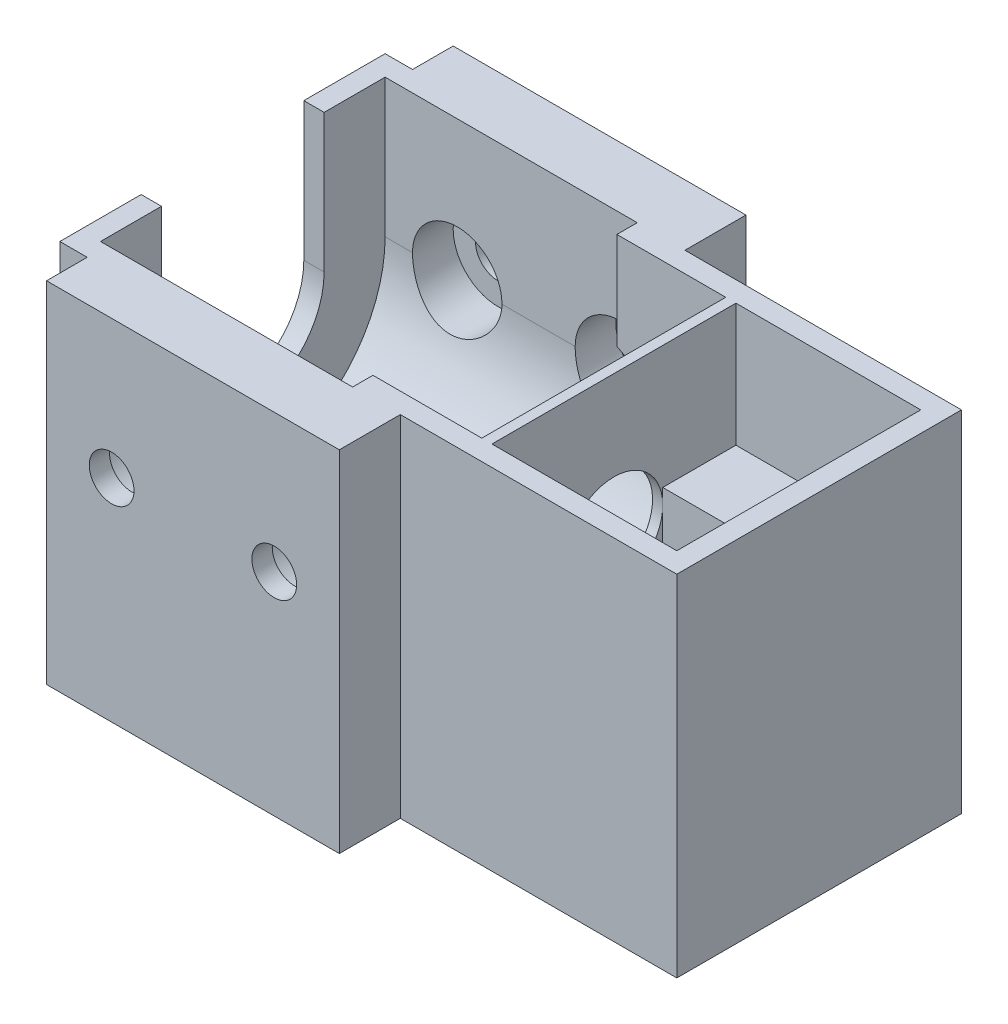
from build123d import *
from build123d.topology import SkipClean

# Parameters (mm, degrees)
SKETCH1_W                       = 116.84
SKETCH1_H                       = 50.8
BOSS_EXTRUDE1_DEPTH             = 31.75
SKETCH38_W                      = 20
SKETCH38_H                      = 20
CUT_EXTRUDE33_DEPTH             = 32.0434
SKETCH37_W                      = 63.5
SKETCH37_H                      = 25.4
CUT_EXTRUDE32_DEPTH             = 132.302277589
BOSS_EXTRUDE5_DEPTH             = 25.4
BOSS_EXTRUDE6_REACH             = 98.929
SKETCH40_W                      = 15.6309
SKETCH40_H                      = 20
SKETCH41_R                      = 3.113413941
CUT_EXTRUDE34_DEPTH             = 97.928543268
CUT_EXTRUDE35_DEPTH             = 97.928543399
CUT_EXTRUDE35_DEPTH_BACK        = 97.928543399
SKETCH42_R                      = 3.4925
SKETCH43_R                      = 6.985
CUT_EXTRUDE36_DEPTH             = 28.575
CUT_EXTRUDE37_START             = 28.575
SKETCH43_2_R                    = 6.985
CUT_EXTRUDE37_DEPTH             = 28.575
SKETCH44_W                      = 15.9125
SKETCH44_H                      = 38.1
CUT_EXTRUDE38_DEPTH             = 35.4
CUT_EXTRUDE39_REACH             = 98.929
SKETCH45_W                      = 12.9559
SKETCH45_H                      = 15.4
CUT_EXTRUDE39_DIRECTION_2_REACH = 98.929
SKETCH46_W                      = 43.18
SKETCH46_H                      = 9.525
SKETCH46_W_2                    = 27.94
SKETCH46_H_2                    = 6.35
CUT_EXTRUDE40_DEPTH             = 97.928543399
SKETCH49_W                      = 23.6641
SKETCH49_H                      = 50.8
CUT_EXTRUDE42_DEPTH             = 97.928543399
SKETCH50_W                      = 0.254
SKETCH50_H                      = 1.524
CUT_EXTRUDE43_DEPTH             = 2.54
SKETCH52_R                      = 0.3175
CUT_EXTRUDE45_DEPTH             = 0.0508
SKETCH53_R                      = 2
CUT_EXTRUDE46_DEPTH             = 0.0254
BOSS_EXTRUDE7_DEPTH             = 2.54
SKETCH55_W                      = 15.9125
SKETCH55_H                      = 9.05
BOSS_EXTRUDE8_DEPTH             = 17.46
BOSS_EXTRUDE9_REACH             = 81.679
BOSS_EXTRUDE9_DIRECTION_2_REACH = 81.679
CUT_EXTRUDE47_DEPTH             = 7.62
SKETCH58_R                      = 3.113413941
BOSS_EXTRUDE10_DEPTH            = 7.62
SKETCH59_W                      = 0.5
SKETCH59_H                      = 20
CUT_EXTRUDE48_DEPTH             = 7.62
CUT_LABEL_DEPTH                 = 0.635
SKETCH60_W                      = 121.35651469
SKETCH60_H                      = 81.059088534
CUT_EXTRUDE49_DEPTH             = 10.16
SKETCH61_R                      = 8.976217823
SKETCH61_R_2                    = 7.62
BOSS_EXTRUDE11_DEPTH            = 1.5875
BOSS_EXTRUDE12_REACH            = 80.084
SKETCH62_W                      = 1.5875
SKETCH62_H                      = 15.24
SKETCH64_W                      = 28.8684
SKETCH64_H                      = 38.1
BOSS_EXTRUDE14_DEPTH            = 6.35
BOSS_EXTRUDE16_REACH            = 92.322
SKETCH65_W                      = 2.38
SKETCH65_H                      = 9.84
SKETCH66_W                      = 0.5
SKETCH66_H                      = 20
CUT_EXTRUDE50_DEPTH             = 20


with BuildPart() as part:
    # Sketch1 → Boss-Extrude1 (new, symmetric)
    with BuildSketch(Plane.XY):
        with Locations((-17.78, -25.4)):
            Rectangle(SKETCH1_W, SKETCH1_H)
    extrude(amount=BOSS_EXTRUDE1_DEPTH, both=True)

    # Sketch2 → Cut-Revolve1 (revolve, cut)
    with BuildSketch(Plane.XY, mode=Mode.PRIVATE) as cut_revolve1_sk:
        Polygon((-49.3609, -3.175), (-49.3609, -12.7), (-220.202391615, -12.7), (-220.202391615, -25.4), (-157.809194346, -25.4), (-128.417210056, -25.4), (9.3782, -25.4), (40.64, -25.4), (40.64, -17.78), (25.0091, -17.78), (7.0091, -17.78), (7.0091, -6.35), (-9.9909, -6.35), (-9.9909, -3.175), align=None)
    revolve(cut_revolve1_sk.sketch.rotate(Axis((-152.482877195, -25.4, 0), (1, 0, 0)), 180), axis=Axis((-152.482877195, -25.4, 0), (1, 0, 0)), mode=Mode.SUBTRACT)

    # Sketch38 → Cut-Extrude33 (cut)
    with BuildSketch(Plane(origin=(40.64, 0, 0), x_dir=(0, 0, -1), z_dir=(1, 0, 0))):
        with Locations((0, -25.4)):
            Rectangle(SKETCH38_W, SKETCH38_H)
    extrude(amount=-CUT_EXTRUDE33_DEPTH, mode=Mode.SUBTRACT)

    # Sketch37 → Cut-Extrude32 (cut, through all)
    with BuildSketch(Plane(origin=(40.64, 0, 0), x_dir=(0, 0, -1), z_dir=(1, 0, 0))):
        with Locations((0, -12.7)):
            Rectangle(SKETCH37_W, SKETCH37_H)
    extrude(amount=-CUT_EXTRUDE32_DEPTH, mode=Mode.SUBTRACT)

    # Sketch39 → Boss-Extrude5 (add)
    with BuildSketch(Plane(origin=(0, -25.4, 0), x_dir=(1, 0, 0), z_dir=(0, 1, 0))):
        Polygon((7.0091, 19.05), (7.0091, 7.62), (8.5966, 7.62), (8.5966, 10), (40.64, 10), (40.64, 31.75), (-76.2, 31.75), (-76.2, 12.7), (-49.3609, 12.7), (-49.3609, 22.225), (-9.9909, 22.225), (-9.9909, 19.05), align=None)
        Polygon((40.64, -10), (8.5966, -10), (8.5966, -7.62), (7.0091, -7.62), (7.0091, -19.05), (-9.9909, -19.05), (-9.9909, -22.225), (-49.3609, -22.225), (-49.3609, -12.7), (-76.2, -12.7), (-76.2, -31.75), (40.64, -31.75), align=None)
    extrude(amount=BOSS_EXTRUDE5_DEPTH)

    # Sketch40 → Boss-Extrude6 (add, up to next)
    with BuildSketch(Plane(origin=(0, 0, 0), x_dir=(1, 0, 0), z_dir=(0, 1, 0)), mode=Mode.PRIVATE) as boss_extrude6_sk1:
        with Locations((32.82455, 0)):
            Rectangle(SKETCH40_W, SKETCH40_H)
    boss_extrude6_tool1 = extrude(boss_extrude6_sk1.sketch, amount=-BOSS_EXTRUDE6_REACH, mode=Mode.PRIVATE) - part.part
    add(boss_extrude6_tool1.solids().sort_by_distance((32.82455, 0, 0))[0])

    # Sketch41 → Cut-Extrude34 (cut, through all)
    with BuildSketch(Plane(origin=(0, 0, 0), x_dir=(1, 0, 0), z_dir=(0, 1, 0))):
        with Locations(Location((-57.15, 0, 0), (0, 0, 270))):
            Circle(SKETCH41_R)
        with Locations(Location((-31.75, 0, 0), (0, 0, 270))):
            Circle(SKETCH41_R)
        with Locations(Location((-6.35, 0, 0), (0, 0, 270))):
            Circle(SKETCH41_R)
    extrude(amount=-CUT_EXTRUDE34_DEPTH, mode=Mode.SUBTRACT)

    # Sketch42 → Cut-Extrude35 (cut, two sides: drawn at the far end of the back side and taken through both)
    with BuildSketch(Plane.XY.offset(-CUT_EXTRUDE35_DEPTH_BACK)):
        with Locations((-38.1, -25.4)):
            Circle(SKETCH42_R)
        with Locations((-12.7, -25.4)):
            Circle(SKETCH42_R)
    extrude(amount=CUT_EXTRUDE35_DEPTH + CUT_EXTRUDE35_DEPTH_BACK, mode=Mode.SUBTRACT)

    # Sketch43 → Cut-Extrude36 (cut)
    with BuildSketch(Plane.XY):
        with Locations(Location((-38.1, -25.4, 0), (0, 0, 180))):
            Circle(SKETCH43_R)
        with Locations(Location((-12.7, -25.4, 0), (0, 0, 180))):
            Circle(SKETCH43_R)
    extrude(amount=-CUT_EXTRUDE36_DEPTH, mode=Mode.SUBTRACT)

    # Sketch43<2> → Cut-Extrude37 (cut)
    with BuildSketch(Plane.XY.offset(CUT_EXTRUDE37_START)):
        with Locations(Location((-38.1, -25.4, 0), (0, 0, 180))):
            Circle(SKETCH43_2_R)
        with Locations(Location((-12.7, -25.4, 0), (0, 0, 180))):
            Circle(SKETCH43_2_R)
    extrude(amount=-CUT_EXTRUDE37_DEPTH, mode=Mode.SUBTRACT)

    # Sketch44 → Cut-Extrude38 (cut)
    with BuildSketch(Plane(origin=(0, 0, 0), x_dir=(1, 0, 0), z_dir=(0, 1, 0))):
        with Locations((16.55285, 0)):
            Rectangle(SKETCH44_W, SKETCH44_H)
    extrude(amount=-CUT_EXTRUDE38_DEPTH, mode=Mode.SUBTRACT)

    # Cut-Extrude39: up to this face of the body (flat: up to its plane)
    cut_extrude39_end = Plane(part.part.faces().sort_by_distance((16.55285, -17.7, -19.05))[0])
    # Sketch45 → Cut-Extrude39 (cut, up to the picked face)
    with BuildSketch(Plane.XY, mode=Mode.PRIVATE) as cut_extrude39_sk1:
        with Locations((30.98705, -7.7)):
            Rectangle(SKETCH45_W, SKETCH45_H)
    cut_extrude39_tool1 = split(extrude(cut_extrude39_sk1.sketch, amount=-CUT_EXTRUDE39_REACH, mode=Mode.PRIVATE), bisect_by=cut_extrude39_end, keep=Keep.BOTH, mode=Mode.PRIVATE)
    add(cut_extrude39_tool1.solids().sort_by(Axis((30.98705, -7.7, 0), (0, 0, -1)))[0], mode=Mode.SUBTRACT)

    # Cut-Extrude39 direction 2: up to this face of the body (flat: up to its plane)
    cut_extrude39_direction_2_end = Plane(part.part.faces().sort_by_distance((16.55285, -17.7, 19.05))[0])
    # Sketch45 → Cut-Extrude39 direction 2 (cut, up to the picked face)
    with BuildSketch(Plane.XY, mode=Mode.PRIVATE) as cut_extrude39_direction_2_sk1:
        with Locations((30.98705, -7.7)):
            Rectangle(SKETCH45_W, SKETCH45_H)
    cut_extrude39_direction_2_tool1 = split(extrude(cut_extrude39_direction_2_sk1.sketch, amount=CUT_EXTRUDE39_DIRECTION_2_REACH, mode=Mode.PRIVATE), bisect_by=cut_extrude39_direction_2_end, keep=Keep.BOTH, mode=Mode.PRIVATE)
    add(cut_extrude39_direction_2_tool1.solids().sort_by(Axis((30.98705, -7.7, 0), (0, 0, 1)))[0], mode=Mode.SUBTRACT)

    # Sketch46 → Cut-Extrude40 (cut, through all)
    with BuildSketch(Plane(origin=(0, 0, 0), x_dir=(1, 0, 0), z_dir=(0, 1, 0))):
        with Locations((19.05, 26.9875)):
            Rectangle(SKETCH46_W, SKETCH46_H)
        with Locations((19.05, -26.9875)):
            Rectangle(SKETCH46_W, SKETCH46_H)
        with Locations((-62.23, 28.575)):
            Rectangle(SKETCH46_W_2, SKETCH46_H_2)
        with Locations((-62.23, -28.575)):
            Rectangle(SKETCH46_W_2, SKETCH46_H_2)
    extrude(amount=-CUT_EXTRUDE40_DEPTH, mode=Mode.SUBTRACT)

    # Sketch49 → Cut-Extrude42 (cut, through all)
    with BuildSketch(Plane(origin=(0, 0, 0), x_dir=(1, 0, 0), z_dir=(0, 1, 0))):
        with Locations((-64.36795, 0)):
            Rectangle(SKETCH49_W, SKETCH49_H)
    extrude(amount=-CUT_EXTRUDE42_DEPTH, mode=Mode.SUBTRACT)

    # Sketch50 → Cut-Extrude43 (cut)
    with BuildSketch(Plane(origin=(0, 0, 0), x_dir=(1, 0, 0), z_dir=(0, 1, 0))):
        with Locations((24.3821, 21.463)):
            Rectangle(SKETCH50_W, SKETCH50_H)
        with Locations((22.8581, 21.463)):
            Rectangle(SKETCH50_W, SKETCH50_H)
        with Locations((21.3341, 21.463)):
            Rectangle(SKETCH50_W, SKETCH50_H)
        with Locations((19.8101, 21.463)):
            Rectangle(SKETCH50_W, SKETCH50_H)
        with Locations((18.2861, 21.463)):
            Rectangle(SKETCH50_W, SKETCH50_H)
        with Locations((16.7621, 21.463)):
            Rectangle(SKETCH50_W, SKETCH50_H)
        with Locations((15.2381, 21.463)):
            Rectangle(SKETCH50_W, SKETCH50_H)
        with Locations((13.7141, 21.463)):
            Rectangle(SKETCH50_W, SKETCH50_H)
        with Locations((12.1901, 21.463)):
            Rectangle(SKETCH50_W, SKETCH50_H)
        with Locations((10.6661, 21.463)):
            Rectangle(SKETCH50_W, SKETCH50_H)
    extrude(amount=-CUT_EXTRUDE43_DEPTH, mode=Mode.SUBTRACT)

    # Sketch52 → Cut-Extrude45 (cut)
    with BuildSketch(Plane.ZY.offset(-25.0091)):
        with Locations(Location((0, -25.4, 0), (0, 0, 270))):
            Circle(SKETCH52_R)
    extrude(amount=-CUT_EXTRUDE45_DEPTH, mode=Mode.SUBTRACT)

    # Sketch53 → Cut-Extrude46 (cut)
    with BuildSketch(Plane.ZY.offset(-25.0091)):
        with Locations(Location((0, -25.4, 0), (0, 0, 270))):
            Circle(SKETCH53_R)
    extrude(amount=-CUT_EXTRUDE46_DEPTH, mode=Mode.SUBTRACT)

    # Sketch54 → Boss-Extrude7 (add)
    with BuildSketch(Plane(origin=(0, -35.4, 0), x_dir=(1, 0, 0), z_dir=(0, 1, 0))):
        Polygon((24.5091, 10), (24.5091, -10), (24.5091, -19.05), (8.5966, -19.05), (8.5966, 19.05), (24.5091, 19.05), align=None)
    extrude(amount=BOSS_EXTRUDE7_DEPTH)

    # Sketch55 → Boss-Extrude8 (add)
    with BuildSketch(Plane(origin=(0, -32.86, 0), x_dir=(1, 0, 0), z_dir=(0, 1, 0))):
        with Locations((16.55285, 14.525)):
            Rectangle(SKETCH55_W, SKETCH55_H)
        with Locations((16.55285, -14.525)):
            Rectangle(SKETCH55_W, SKETCH55_H)
    extrude(amount=BOSS_EXTRUDE8_DEPTH)

    # Sketch56 → Boss-Extrude9 (add, up to next)
    with BuildSketch(Plane.XY, mode=Mode.PRIVATE) as boss_extrude9_sk1:
        with BuildLine():
            Line((18.1591, -27.4), (24.5091, -27.4))
            Line((24.5091, -27.4), (24.5091, -32.86))
            Line((24.5091, -32.86), (8.5966, -32.86))
            add(Edge.make_bspline(
                [(8.5966, -32.86), (9.528769565, -32.86), (16.494480894, -27.985980084), (16.841325546, -27.4), (18.1591, -27.4)],
                knots=[0, 0, 0, 0, 0.327130602, 1, 1, 1, 1], degree=3))
        make_face()
    boss_extrude9_tool1 = extrude(boss_extrude9_sk1.sketch, amount=BOSS_EXTRUDE9_REACH, mode=Mode.PRIVATE) - part.part
    add(boss_extrude9_tool1.solids().sort_by_distance((18.670191, -30.455241, 0))[0])

    # Sketch56 → Boss-Extrude9 direction 2 (add, up to next)
    with BuildSketch(Plane.XY, mode=Mode.PRIVATE) as boss_extrude9_direction_2_sk1:
        with BuildLine():
            Line((18.1591, -27.4), (24.5091, -27.4))
            Line((24.5091, -27.4), (24.5091, -32.86))
            Line((24.5091, -32.86), (8.5966, -32.86))
            add(Edge.make_bspline(
                [(8.5966, -32.86), (9.528769565, -32.86), (16.494480894, -27.985980084), (16.841325546, -27.4), (18.1591, -27.4)],
                knots=[0, 0, 0, 0, 0.327130602, 1, 1, 1, 1], degree=3))
        make_face()
    boss_extrude9_direction_2_tool1 = extrude(boss_extrude9_direction_2_sk1.sketch, amount=-BOSS_EXTRUDE9_DIRECTION_2_REACH, mode=Mode.PRIVATE) - part.part
    add(boss_extrude9_direction_2_tool1.solids().sort_by_distance((18.670191, -30.455241, 0))[0])

    # Sketch57 → Cut-Extrude47 (cut)
    with BuildSketch(Plane(origin=(0, -15.4, 0), x_dir=(1, 0, 0), z_dir=(0, 1, 0))):
        Polygon((25.0091, -10), (8.5966, -10), (8.5966, -19.05), (37.465, -19.05), (37.465, 19.05), (8.5966, 19.05), (8.5966, 10), (25.0091, 10), align=None)
    extrude(amount=-CUT_EXTRUDE47_DEPTH, mode=Mode.SUBTRACT)

    # Sketch58 → Boss-Extrude10 (add)
    with SkipClean():  # the faces are left unmerged after this step: merging them gives an invalid solid
        with BuildSketch(Plane.XZ.offset(50.8)):
            Polygon((-48.26, 25.4), (-52.5359, 25.4), (-52.5359, -25.4), (-48.26, -25.4), (-48.26, -31.75), (-2.54, -31.75), (-2.54, -22.225), (40.64, -22.225), (40.64, 22.225), (-2.54, 22.225), (-2.54, 31.75), (-48.26, 31.75), align=None)
            with Locations((-31.75, 0)):
                Circle(SKETCH58_R, mode=Mode.SUBTRACT)
            with Locations(Location((-6.35, 0, 0), (0, 0, 90))):
                Circle(SKETCH58_R, mode=Mode.SUBTRACT)
        extrude(amount=BOSS_EXTRUDE10_DEPTH)

    # Sketch59 → Cut-Extrude48 (cut)
    with SkipClean():  # the faces are left unmerged after this step: merging them gives an invalid solid
        with BuildSketch(Plane(origin=(0, -35.4, 0), x_dir=(1, 0, 0), z_dir=(0, 1, 0))):
            with Locations((24.7591, 0)):
                Rectangle(SKETCH59_W, SKETCH59_H)
        extrude(amount=-CUT_EXTRUDE48_DEPTH, mode=Mode.SUBTRACT)

    # Sketch51 → Cut-Label (cut)
    # profile 1 of 3: a face of its own
    with SkipClean():  # the faces are left unmerged after this step: merging them gives an invalid solid
        with BuildSketch(Plane(origin=(0, -23.02, 0), x_dir=(1, 0, 0), z_dir=(0, 1, 0))):
            Polygon((26.20246966, 0.254), (27.21268828, 0.254), (27.21268828, 2.54), (27.72068828, 2.54), (27.72068828, 0.254), (28.7309069, 0.254), (28.7309069, 2.54), (29.2389069, 2.54), (29.2389069, 0.254), (30.24912552, 0.254), (30.24912552, 2.54), (30.75712552, 2.54), (30.75712552, 0.254), (31.76734414, 0.254), (31.76734414, 2.54), (32.27534414, 2.54), (32.27534414, 0.254), (33.28556276, 0.254), (33.28556276, 2.54), (33.79356276, 2.54), (33.79356276, 0.254), (34.80378138, 0.254), (34.80378138, 2.54), (35.31178138, 2.54), (35.31178138, 0.254), (36.322, 0.254), (36.322, 2.54), (36.83, 2.54), (36.83, 0.254), (37.465, 0.254), (37.465, -0.254), (36.83, -0.254), (36.83, -2.54), (36.322, -2.54), (36.322, -0.254), (35.31178138, -0.254), (35.31178138, -2.54), (34.80378138, -2.54), (34.80378138, -0.254), (33.79356276, -0.254), (33.79356276, -2.54), (33.28556276, -2.54), (33.28556276, -0.254), (32.27534414, -0.254), (32.27534414, -2.54), (31.76734414, -2.54), (31.76734414, -0.254), (30.75712552, -0.254), (30.75712552, -2.54), (30.24912552, -2.54), (30.24912552, -0.254), (29.2389069, -0.254), (29.2389069, -2.54), (28.7309069, -2.54), (28.7309069, -0.254), (27.72068828, -0.254), (27.72068828, -2.54), (27.21268828, -2.54), (27.21268828, -0.254), (26.20246966, -0.254), (26.20246966, -2.54), (25.69446966, -2.54), (25.69446966, -0.254), (25.0091, -0.254), (25.0091, 0.254), (25.69446966, 0.254), (25.69446966, 2.54), (26.20246966, 2.54), align=None)
        # profile 2 of 3: a face of its own
        with BuildSketch(Plane(origin=(0, -23.02, 0), x_dir=(1, 0, 0), z_dir=(0, 1, 0))):
            Polygon((27.745064103, 14.333054385), (28.384487179, 14.333054385), (29.046346154, 12.82353916), (29.708205128, 14.333054385), (30.347628205, 14.333054385), (29.227235577, 11.775362077), (28.865456731, 11.775362077), align=None)
        # profile 3 of 3: a face of its own
        with BuildSketch(Plane(origin=(0, -23.02, 0), x_dir=(1, 0, 0), z_dir=(0, 1, 0))):
            with BuildLine():
                add(Edge.make_bspline(
                    [(32.448189103, 13.659977461), (32.484891011, 13.633752956), (32.557539127, 13.581843914), (32.653480714, 13.488846925), (32.736119869, 13.385107704), (32.804588791, 13.271262569), (32.859444025, 13.150109861), (32.89871205, 13.022944558), (32.923654649, 12.890888291), (32.926379125, 12.8009807), (32.92775641, 12.755530346)],
                    knots=[0, 0, 0, 0, 1.013736912, 2.006600758, 2.994453809, 3.989973287, 4.987781207, 5.978959008, 6.978317308, 8, 8, 8, 8], degree=3))
                add(Edge.make_bspline(
                    [(32.92775641, 12.755530346), (32.92609482, 12.706315612), (32.92279927, 12.608704505), (32.893662198, 12.46555783), (32.846883799, 12.32803516), (32.782951988, 12.197654396), (32.702793256, 12.078467273), (32.609360797, 11.972952704), (32.502536835, 11.883866382), (32.4030807, 11.823421888), (32.31747533, 11.783269753), (32.248392548, 11.757573192), (32.175445671, 11.734950967), (32.09811416, 11.716877309), (32.016412079, 11.702767854), (31.930456024, 11.693449995), (31.840189413, 11.68667648), (31.778631401, 11.685977098), (31.747067308, 11.685618487)],
                    knots=[0, 0, 0, 0, 1.313679292, 2.605514271, 3.884962679, 5.186178731, 6.472827995, 7.711026938, 8.938935107, 10.174644318, 10.808706728, 11.462743532, 12.142127587, 12.847854939, 13.582806024, 14.355735269, 15.156897313, 16, 16, 16, 16], degree=3))
                add(Edge.make_bspline(
                    [(31.747067308, 11.685618487), (31.713407333, 11.68607507), (31.647676041, 11.686966687), (31.551722995, 11.692357873), (31.461210926, 11.702297129), (31.37594997, 11.71538139), (31.296022156, 11.73269566), (31.221425118, 11.754649206), (31.151978731, 11.77964576), (31.066972707, 11.817705159), (30.969826237, 11.877143061), (30.86482847, 11.964188155), (30.772667295, 12.067861581), (30.692541881, 12.185253242), (30.629384009, 12.315640945), (30.582417934, 12.454932244), (30.554604067, 12.602749676), (30.551255589, 12.70399735), (30.549551282, 12.755530346)],
                    knots=[0, 0, 0, 0, 0.886964665, 1.7320671, 2.531131818, 3.285397207, 4.004107883, 4.684213108, 5.332925796, 5.947568694, 7.135706876, 8.320776993, 9.52873045, 10.778999824, 12.05415135, 13.333578234, 14.642845846, 16, 16, 16, 16], degree=3))
                add(Edge.make_bspline(
                    [(30.549551282, 12.755530346), (30.551108733, 12.800484407), (30.554169313, 12.88882458), (30.57609266, 13.018270873), (30.613684538, 13.141001275), (30.665266446, 13.257870185), (30.731780441, 13.368890607), (30.813619848, 13.473245649), (30.909747025, 13.57187674), (30.98264206, 13.630123438), (31.020004006, 13.659977461)],
                    knots=[0, 0, 0, 0, 1.01821053, 2.000906977, 2.963938143, 3.919209931, 4.888045165, 5.887808425, 6.917407893, 8, 8, 8, 8], degree=3))
                add(Edge.make_bspline(
                    [(31.020004006, 13.659977461), (30.996841581, 13.68669193), (30.951241741, 13.739284674), (30.8922351, 13.823928503), (30.84252449, 13.91119638), (30.800317815, 14.000380079), (30.769117565, 14.093015122), (30.745522983, 14.187645096), (30.732177911, 14.285234063), (30.730092035, 14.351011928), (30.729038462, 14.384236276)],
                    knots=[0, 0, 0, 0, 1.061529281, 2.089831458, 3.092927091, 4.075998741, 5.048384512, 6.024008542, 7.00192825, 8, 8, 8, 8], degree=3))
                add(Edge.make_bspline(
                    [(30.729038462, 14.384236276), (30.73043534, 14.429212248), (30.733191328, 14.517948109), (30.757600953, 14.647700889), (30.798126857, 14.770991891), (30.853258901, 14.887460137), (30.923268029, 14.994567327), (31.006454029, 15.090618533), (31.103986333, 15.172095437), (31.212237978, 15.242006217), (31.33175157, 15.297612603), (31.461393179, 15.336521787), (31.599597361, 15.361153352), (31.694843558, 15.363768187), (31.743561699, 15.365105667)],
                    knots=[0, 0, 0, 0, 1.022455555, 2.017265428, 2.990720743, 3.968117071, 4.939886797, 5.893155559, 6.847550415, 7.820889576, 8.817530429, 9.83499769, 10.892607882, 12, 12, 12, 12], degree=3))
                add(Edge.make_bspline(
                    [(31.743561699, 15.365105667), (31.791578171, 15.363765998), (31.885200239, 15.361153924), (32.020975667, 15.336685568), (32.147815695, 15.296909675), (32.264671448, 15.24012919), (32.37180356, 15.170083665), (32.467678229, 15.085769811), (32.550603189, 14.987326294), (32.621193437, 14.877448273), (32.677443017, 14.759070625), (32.719028133, 14.634927085), (32.743081455, 14.505993435), (32.746533057, 14.41845357), (32.748269231, 14.37442057)],
                    knots=[0, 0, 0, 0, 1.094655142, 2.134348324, 3.136019022, 4.118575226, 5.088726318, 6.048298823, 7.020513804, 8.015920439, 9.020015034, 10.003048569, 10.995523219, 12, 12, 12, 12], degree=3))
                add(Edge.make_bspline(
                    [(32.748269231, 14.37442057), (32.747432874, 14.343300427), (32.745791587, 14.282229473), (32.73365624, 14.192254723), (32.713221805, 14.105923829), (32.684731577, 14.021150529), (32.645120433, 13.93563106), (32.591517346, 13.847726713), (32.526316229, 13.753785045), (32.475110535, 13.692302143), (32.448189103, 13.659977461)],
                    knots=[0, 0, 0, 0, 0.940746401, 1.846144481, 2.739104268, 3.619506754, 4.545839139, 5.581956076, 6.728711598, 8, 8, 8, 8], degree=3))
            make_face()
            with BuildLine():
                add(Edge.make_bspline(
                    [(31.728137019, 14.736900538), (31.702272502, 14.735653629), (31.651960302, 14.733228116), (31.580170684, 14.711335169), (31.515629475, 14.675527697), (31.459809956, 14.626249569), (31.41403504, 14.566457943), (31.380392992, 14.497715251), (31.36044286, 14.420869854), (31.358330751, 14.367061251), (31.35724359, 14.339364481)],
                    knots=[0, 0, 0, 0, 1.018099191, 1.980427864, 2.929421084, 3.909248076, 4.895556904, 5.880788387, 6.909183412, 8, 8, 8, 8], degree=3))
                add(Edge.make_bspline(
                    [(31.35724359, 14.339364481), (31.358586566, 14.311431174), (31.361208856, 14.256888702), (31.381830224, 14.178566855), (31.416979914, 14.107584989), (31.465240202, 14.045425681), (31.523884267, 13.994655756), (31.589547642, 13.955880513), (31.662958546, 13.933744732), (31.71397208, 13.930743042), (31.74005609, 13.929208231)],
                    knots=[0, 0, 0, 0, 1.07118507, 2.091592095, 3.082435519, 4.092579768, 5.090825648, 6.043203473, 6.999459622, 8, 8, 8, 8], degree=3))
                add(Edge.make_bspline(
                    [(31.74005609, 13.929208231), (31.766633232, 13.930397446), (31.81841049, 13.93271426), (31.892004692, 13.955424403), (31.958303662, 13.991744647), (32.015078935, 14.043093437), (32.062106302, 14.105275257), (32.096355248, 14.177497594), (32.116067703, 14.258403484), (32.118699386, 14.314949273), (32.120064103, 14.344272333)],
                    knots=[0, 0, 0, 0, 1.008803858, 1.965339183, 2.900766489, 3.864508618, 4.855158575, 5.849593072, 6.884859315, 8, 8, 8, 8], degree=3))
                add(Edge.make_bspline(
                    [(32.120064103, 14.344272333), (32.118664864, 14.371950794), (32.115958786, 14.425479964), (32.096555171, 14.502330346), (32.060919461, 14.570000129), (32.014098736, 14.629420461), (31.955398094, 14.677339263), (31.887250949, 14.712579039), (31.810159107, 14.733018451), (31.75606978, 14.735578487), (31.728137019, 14.736900538)],
                    knots=[0, 0, 0, 0, 1.065910571, 2.061433587, 3.023559535, 3.990682701, 4.956464619, 5.918590567, 6.925120432, 8, 8, 8, 8], degree=3))
            make_face(mode=Mode.SUBTRACT)
            with BuildLine():
                add(Edge.make_bspline(
                    [(31.748469551, 13.301003102), (31.728814476, 13.300676701), (31.690074569, 13.300033367), (31.633123722, 13.292614762), (31.578473531, 13.281559207), (31.526191799, 13.26630838), (31.476542649, 13.245517666), (31.429105223, 13.220454075), (31.384043348, 13.190864247), (31.342025416, 13.157285385), (31.304051024, 13.120429385), (31.269820564, 13.081989771), (31.241841996, 13.040972777), (31.21854252, 12.998741819), (31.199821258, 12.954962239), (31.187445089, 12.90891308), (31.179476569, 12.861207586), (31.17833317, 12.828712538), (31.17775641, 12.812321211)],
                    knots=[0, 0, 0, 0, 1.129580664, 2.226389355, 3.296443603, 4.333934503, 5.352185725, 6.386189251, 7.41493955, 8.447544828, 9.47401038, 10.455044306, 11.4018853, 12.322125673, 13.225630306, 14.132028716, 15.057747923, 16, 16, 16, 16], degree=3))
                add(Edge.make_bspline(
                    [(31.17775641, 12.812321211), (31.178031304, 12.795226677), (31.178576522, 12.761321782), (31.186811275, 12.71183485), (31.198667864, 12.664108102), (31.215320823, 12.61858829), (31.23759099, 12.575301915), (31.264181975, 12.533828141), (31.296020994, 12.494457788), (31.332244742, 12.457401946), (31.372797066, 12.423970961), (31.416503585, 12.394517682), (31.462787035, 12.368550163), (31.513036812, 12.349847327), (31.565391967, 12.332728849), (31.62125511, 12.32234348), (31.680016091, 12.314701638), (31.72016317, 12.314121305), (31.740757212, 12.313823615)],
                    knots=[0, 0, 0, 0, 0.973817353, 1.931446211, 2.852767904, 3.776304432, 4.688323523, 5.623710549, 6.581246645, 7.570897993, 8.57436511, 9.572506873, 10.574556662, 11.591826551, 12.624694332, 13.712108235, 14.826391851, 16, 16, 16, 16], degree=3))
                add(Edge.make_bspline(
                    [(31.740757212, 12.313823615), (31.761574724, 12.314200957), (31.802141463, 12.314936278), (31.861441878, 12.321435116), (31.917529546, 12.331746883), (31.970337473, 12.34649511), (32.020065354, 12.365388178), (32.066046131, 12.389435314), (32.109329622, 12.416687411), (32.148524908, 12.44852601), (32.184313094, 12.483223438), (32.21514964, 12.521248868), (32.241369613, 12.56137954), (32.262518879, 12.604049066), (32.279584437, 12.649056028), (32.291290339, 12.696849195), (32.298554273, 12.74689148), (32.299215378, 12.78097904), (32.299551282, 12.798298776)],
                    knots=[0, 0, 0, 0, 1.200705402, 2.339794563, 3.437264955, 4.487414319, 5.499029866, 6.500076882, 7.476298407, 8.444948224, 9.407950986, 10.347155707, 11.263432813, 12.167927724, 13.089546445, 14.03463663, 15.00140776, 16, 16, 16, 16], degree=3))
                add(Edge.make_bspline(
                    [(32.299551282, 12.798298776), (32.298909903, 12.815844942), (32.297656228, 12.850141616), (32.290796306, 12.900788722), (32.277927791, 12.948802971), (32.261092015, 12.995297932), (32.238696567, 13.039311471), (32.210893103, 13.080750698), (32.179245937, 13.12064211), (32.142257391, 13.157209888), (32.101816169, 13.190645834), (32.058772933, 13.220433591), (32.013260263, 13.245661075), (31.965153665, 13.26628329), (31.914277371, 13.281567143), (31.861019567, 13.292614374), (31.805467617, 13.300035027), (31.767657892, 13.300677201), (31.748469551, 13.301003102)],
                    knots=[0, 0, 0, 0, 1.011708178, 1.977538892, 2.938094892, 3.871441737, 4.823268678, 5.775953079, 6.743660653, 7.753304209, 8.767430709, 9.76505158, 10.765940967, 11.761741361, 12.775867861, 13.822051386, 14.89469657, 16, 16, 16, 16], degree=3))
            make_face(mode=Mode.SUBTRACT)
        extrude(amount=-CUT_LABEL_DEPTH, mode=Mode.SUBTRACT)

    # Sketch60 → Cut-Extrude49 (cut)
    with SkipClean():  # the faces are left unmerged after this step: merging them gives an invalid solid
        with BuildSketch(Plane(origin=(0, 0, 0), x_dir=(1, 0, 0), z_dir=(0, 1, 0))):
            Rectangle(SKETCH60_W, SKETCH60_H)
        extrude(amount=-CUT_EXTRUDE49_DEPTH, mode=Mode.SUBTRACT)

    # Sketch61 → Boss-Extrude11 (add)
    with SkipClean():  # the faces are left unmerged after this step: merging them gives an invalid solid
        with BuildSketch(Plane.ZY.offset(-7.0091)):
            with Locations((0, -25.4)):
                Circle(SKETCH61_R)
            with Locations(Location((0, -25.4, 0), (0, 0, 270))):
                Circle(SKETCH61_R_2, mode=Mode.SUBTRACT)
        extrude(amount=-BOSS_EXTRUDE11_DEPTH)

    # Sketch62 → Boss-Extrude12 (add, up to next)
    with BuildSketch(Plane(origin=(0, -10.16, 0), x_dir=(1, 0, 0), z_dir=(0, 1, 0)), mode=Mode.PRIVATE) as boss_extrude12_sk1:
        with Locations((7.80285, 0)):
            Rectangle(SKETCH62_W, SKETCH62_H)
    boss_extrude12_tool1 = extrude(boss_extrude12_sk1.sketch, amount=-BOSS_EXTRUDE12_REACH, mode=Mode.PRIVATE) - part.part
    add(boss_extrude12_tool1.solids().sort_by_distance((7.80285, -10.16, 0))[0])

    # Sketch64 → Boss-Extrude14 (add)
    with BuildSketch(Plane(origin=(0, -10.16, 0), x_dir=(1, 0, 0), z_dir=(0, 1, 0))):
        Polygon((-9.9909, 19.05), (7.0091, 19.05), (7.0091, -19.05), (-9.9909, -19.05), (-9.9909, -22.225), (-49.3609, -22.225), (-49.3609, -12.7), (-52.5359, -12.7), (-52.5359, -25.4), (-48.26, -25.4), (-48.26, -31.75), (-2.54, -31.75), (-2.54, -22.225), (40.64, -22.225), (40.64, 22.225), (-2.54, 22.225), (-2.54, 31.75), (-48.26, 31.75), (-48.26, 25.4), (-52.5359, 25.4), (-52.5359, 12.7), (-49.3609, 12.7), (-49.3609, 22.225), (-9.9909, 22.225), align=None)
        with Locations((23.0308, 0)):
            Rectangle(SKETCH64_W, SKETCH64_H, mode=Mode.SUBTRACT)
    extrude(amount=BOSS_EXTRUDE14_DEPTH)

    # Sketch65 → Boss-Extrude16 (add, up to next)
    with BuildSketch(Plane(origin=(8.5966, 0, 0), x_dir=(0, 0, -1), z_dir=(1, 0, 0)), mode=Mode.PRIVATE) as boss_extrude16_sk1:
        with Locations((-8.81, -27.94)):
            Rectangle(SKETCH65_W, SKETCH65_H)
    boss_extrude16_tool1 = extrude(boss_extrude16_sk1.sketch, amount=BOSS_EXTRUDE16_REACH, mode=Mode.PRIVATE) - part.part
    # Sketch65 → Boss-Extrude16 (add, up to next)
    with BuildSketch(Plane(origin=(8.5966, 0, 0), x_dir=(0, 0, -1), z_dir=(1, 0, 0)), mode=Mode.PRIVATE) as boss_extrude16_sk2:
        with Locations((8.81, -27.94)):
            Rectangle(SKETCH65_W, SKETCH65_H)
    boss_extrude16_tool2 = extrude(boss_extrude16_sk2.sketch, amount=BOSS_EXTRUDE16_REACH, mode=Mode.PRIVATE) - part.part
    add(boss_extrude16_tool1.solids().sort_by_distance((8.5966, -27.94, 8.81))[0])
    add(boss_extrude16_tool2.solids().sort_by_distance((8.5966, -27.94, -8.81))[0])

    # Sketch66 → Cut-Extrude50 (cut)
    with BuildSketch(Plane(origin=(0, -23.02, 0), x_dir=(1, 0, 0), z_dir=(0, 1, 0))):
        with Locations((24.7591, 0)):
            Rectangle(SKETCH66_W, SKETCH66_H)
    extrude(amount=-CUT_EXTRUDE50_DEPTH, mode=Mode.SUBTRACT)


solid = part.part
